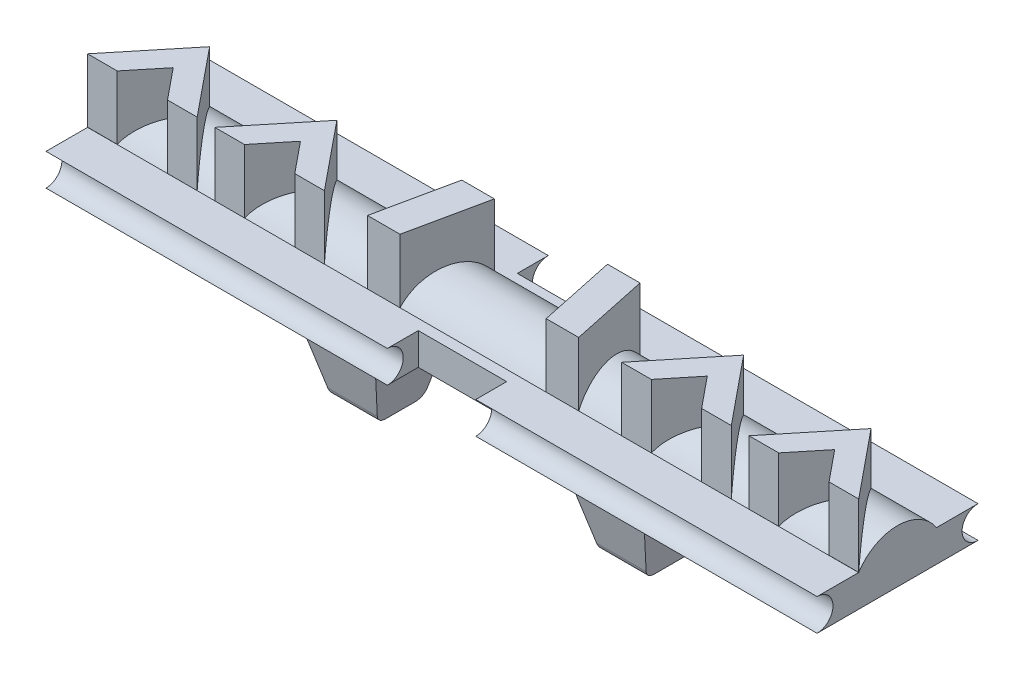
from build123d import *

# Parameters (mm, degrees)
EXTRUDE_1_DEPTH     = 109
EXTRUDE_2_DEPTH     = 18
SKETCH_3_W          = 25
SKETCH_3_H          = 11.25
CUT_EXTRUDE_1_DEPTH = 18
SKETCH_4_W          = 25
SKETCH_4_H          = 27
EXTRUDE_3_DEPTH     = 27
CUT_EXTRUDE_2_DEPTH = 122.166018853
CUT_EXTRUDE_3_DEPTH = 166.462013552
FILLET_1_R          = 3
CUT_EXTRUDE_4_DEPTH = 223.40244064


# Read off the part's stored shape, not the designer's step: Бобышка-Вытянуть2
with BuildPart() as part:
    # Эскиз1 → Бобышка-Вытянуть1 (new, symmetric)
    with BuildSketch(Plane(origin=(0, 0, 0), x_dir=(0, 0, -1), z_dir=(1, 0, 0))):
        with BuildLine():
            Line((11, 0), (25.25, 0))
            Line((25.25, 0), (25.25, -9))
            Line((25.25, -9), (-25.25, -9))
            Line((-25.25, -9), (-25.25, 0))
            Line((-25.25, 0), (-11, 0))
            ThreePointArc((-11, 0), (0, 6), (11, 0))
        make_face()
    extrude(amount=EXTRUDE_1_DEPTH, both=True)

    # Бобышка-Вытянуть2 outline → Бобышка-Вытянуть2 (add)
    with BuildSketch(Plane(origin=(0, 0, 0), x_dir=(1, 0, 0), z_dir=(0, 1, 0))):
        Polygon((16, 11), (20.656976684, -11), (29.856406461, -11), (25.199429777, 11), align=None)
        Polygon((-29.856406461, -11), (-20.656976684, -11), (-16, 11), (-25.199429777, 11), align=None)
        Polygon((78.012123179, -10.999996132), (86.400679256, -10.994643711), (93.506557878, -2.272856192), (100.623560797, -10.985568626), (109.012116871, -10.980216204), (93.499996845, 8.009889964), align=None)
        Polygon((64.623554487, -11.008538874), (73.012110561, -11.003186452), (57.499990534, 7.986919716), (42.012116871, -11.02296638), (50.400672946, -11.017613959), (57.506551567, -2.29582644), align=None)
        Polygon((-109.012116871, -10.980216204), (-100.623560797, -10.985568626), (-93.506557878, -2.272856192), (-86.400679256, -10.994643711), (-78.012123179, -10.999996132), (-93.499996845, 8.009889964), align=None)
        Polygon((-73.012110561, -11.003186452), (-64.623554487, -11.008538874), (-57.506551567, -2.29582644), (-50.400672946, -11.017613959), (-42.012116871, -11.02296638), (-57.499990534, 7.986919716), align=None)
    extrude(amount=EXTRUDE_2_DEPTH)

    # Эскиз3 → Вырез-Вытянуть1 (cut)
    with BuildSketch(Plane(origin=(0, 0, 0), x_dir=(1, 0, 0), z_dir=(0, 1, 0))):
        with Locations((0, 19.625)):
            Rectangle(SKETCH_3_W, SKETCH_3_H)
        with Locations((0, -19.625)):
            Rectangle(SKETCH_3_W, SKETCH_3_H)
    extrude(amount=-CUT_EXTRUDE_1_DEPTH, mode=Mode.SUBTRACT)

    # Эскиз4 → Бобышка-Вытянуть3 (add)
    with BuildSketch(Plane.XZ.offset(9)):
        with Locations((38, 0)):
            Rectangle(SKETCH_4_W, SKETCH_4_H)
        with Locations((-38, 0)):
            Rectangle(SKETCH_4_W, SKETCH_4_H)
    extrude(amount=EXTRUDE_3_DEPTH)

    # Эскиз6 → Вырез-Вытянуть2 (cut, through all)
    with BuildSketch(Plane.XY.offset(13.5)):
        Polygon((-50.5, -9), (-50.5, -36), (-44.5, -36), align=None)
        Polygon((-25.5, -36), (-31.5, -36), (-25.5, -9), align=None)
        Polygon((25.5, -9), (25.5, -36), (31.5, -36), align=None)
        Polygon((50.5, -36), (44.5, -36), (50.5, -9), align=None)
    extrude(amount=-CUT_EXTRUDE_2_DEPTH, mode=Mode.SUBTRACT)

    # Эскиз5 → Вырез-Вытянуть3 (cut, through all)
    with BuildSketch(Plane.ZY.offset(50.5)):
        Polygon((-13.5, -9), (-13.5, -36), (-6.5, -36), align=None)
        Polygon((13.5, -36), (6.5, -36), (13.5, -9), align=None)
    extrude(amount=-CUT_EXTRUDE_3_DEPTH, mode=Mode.SUBTRACT)

    # Скругление1
    fillet_1_edges = [part.edges().sort_by_distance(p)[0] for p in [
        (-38, -36, -6.5),
        (38, -36, -6.5),
        (-38, -36, 6.5),
        (38, -36, 6.5),
    ]]
    fillet(fillet_1_edges, radius=FILLET_1_R)

    # Эскиз8 → Вырез-Вытянуть4 (cut, through all)
    with BuildSketch(Plane(origin=(109, 0, 0), x_dir=(0, 0, -1), z_dir=(1, 0, 0))):
        with BuildLine():
            Line((-22.75, -9), (-25.25, -9))
            Line((-25.25, -9), (-25.25, 0))
            Line((-25.25, 0), (-22.75, 0))
            ThreePointArc((-22.75, 0), (-18.25, -4.5), (-22.75, -9))
        make_face()
        with BuildLine():
            Line((22.75, -9), (25.25, -9))
            Line((25.25, -9), (25.25, 0))
            Line((25.25, 0), (22.75, 0))
            ThreePointArc((22.75, 0), (18.25, -4.5), (22.75, -9))
        make_face()
    extrude(amount=-CUT_EXTRUDE_4_DEPTH, mode=Mode.SUBTRACT)


solid = part.part
